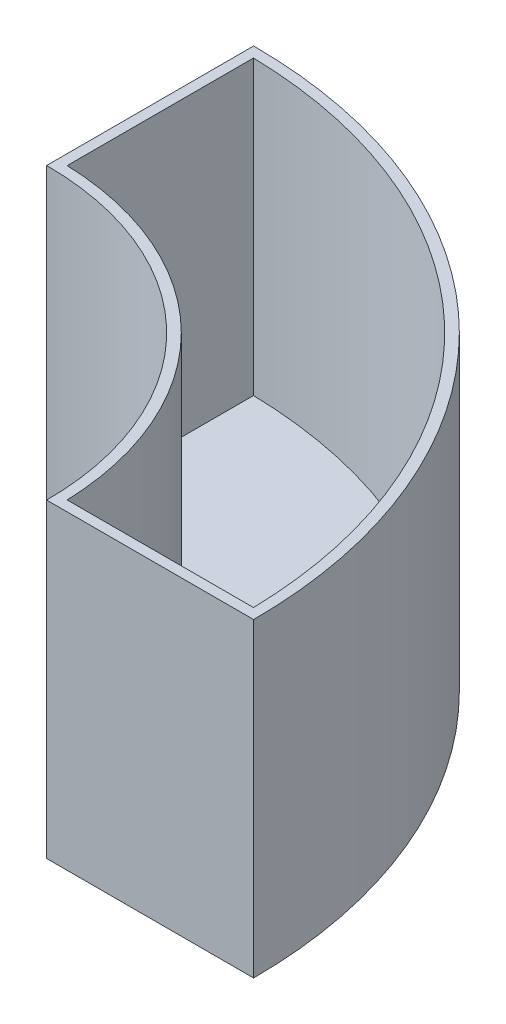
from build123d import *

# Parameters (mm, degrees)
ESTRUSIONE_ESTRUSIONE1_DEPTH = 120
TAGLIO_ESTRUSIONE1_DEPTH     = 113
TAGLIO_ESTRUSIONE2_DEPTH     = 5
RACCORDO1_SIZE               = 5


with BuildPart() as part:
    # Schizzo1 → Estrusione-Estrusione1 (new body)
    with BuildSketch(Plane(origin=(0, 0, 0), x_dir=(1, 0, 0), z_dir=(0, 1, 0))):
        with BuildLine():
            Line((0, 112), (0, 192))
            ThreePointArc((0, 192), (135.764501988, 135.764501988), (192, 0))
            Line((192, 0), (112, 0))
            ThreePointArc((112, 0), (79.195959493, 79.195959493), (0, 112))
        make_face()
    extrude(amount=ESTRUSIONE_ESTRUSIONE1_DEPTH)

    # Schizzo2 → Taglio-Estrusione1 (cut)
    with BuildSketch(Plane(origin=(0, 120, 0), x_dir=(1, 0, 0), z_dir=(0, 1, 0))):
        with BuildLine():
            Line((4, 115.93101397), (4, 187.957441992))
            ThreePointArc((4, 187.957441992), (132.936074863, 132.936074863), (187.957441992, 4))
            Line((187.957441992, 4), (115.93101397, 4))
            ThreePointArc((115.93101397, 4), (82.024386618, 82.024386618), (4, 115.93101397))
        make_face()
    extrude(amount=-TAGLIO_ESTRUSIONE1_DEPTH, mode=Mode.SUBTRACT)

    # Schizzo3 → Taglio-Estrusione2 (cut)
    with BuildSketch(Plane.XZ):
        with BuildLine():
            Line((34.489575502, -148.035364632), (24.129203459, -109.369929782))
            ThreePointArc((24.129203459, -109.369929782), (28.987733051, -108.183692544), (33.788461722, -106.781739331))
            Line((33.788461722, -106.781739331), (44.148833765, -145.447174181))
            ThreePointArc((44.148833765, -145.447174181), (39.340494856, -146.820725596), (34.489575502, -148.035364632))
        make_face()
        with BuildLine():
            Line((145.447174181, -44.148833765), (106.781739331, -33.788461722))
            ThreePointArc((106.781739331, -33.788461722), (108.183692544, -28.987733051), (109.369929782, -24.129203459))
            Line((109.369929782, -24.129203459), (148.035364632, -34.489575502))
            ThreePointArc((148.035364632, -34.489575502), (146.820725596, -39.340494856), (145.447174181, -44.148833765))
        make_face()
    extrude(amount=-TAGLIO_ESTRUSIONE2_DEPTH, mode=Mode.SUBTRACT)

    # Raccordo1
    # a fillet whose section is not a circle: 5 mm, written as the material it takes off along each edge
    with BuildSketch(Plane(origin=(0, 0, 0), x_dir=(0.9892644198784365, 0, -0.14613660582681076), z_dir=(0.14613660582681076, 0, 0.9892644198784365))) as raccordo1_piece_1_section:
        with BuildLine():
            Bezier((152 + RACCORDO1_SIZE, 0), (152, 0), (152, RACCORDO1_SIZE), weights=[1, 1.5, 1])
            Line((152, RACCORDO1_SIZE), (152, 0))
            Line((152, 0), (152 + RACCORDO1_SIZE, 0))
        make_face()
    raccordo1_piece_1 = revolve(axis=Axis((0, 0, 0), (0, 1, 0)), revolution_arc=13.193793896, mode=Mode.PRIVATE)
    raccordo1_piece_1 = split(raccordo1_piece_1, bisect_by=Plane(origin=(-1.294095226, 0, -4.829629131), z_dir=(0.2588190451025214, 0, 0.9659258262890682)), keep=Keep.TOP, mode=Mode.PRIVATE)
    raccordo1_piece_1 = split(raccordo1_piece_1, bisect_by=Plane(origin=(1.294095225, 0, 4.829629131), z_dir=(-0.25881904510252096, 0, -0.9659258262890682)), keep=Keep.TOP, mode=Mode.PRIVATE)
    add(raccordo1_piece_1, mode=Mode.SUBTRACT)
    with BuildSketch(Plane(origin=(0, 0, 0), x_dir=(0.36807419687030923, 0, -0.9297964215882295), z_dir=(0.9297964215882295, 0, 0.36807419687030923))) as raccordo1_piece_2_section:
        with BuildLine():
            Bezier((152 + RACCORDO1_SIZE, 0), (152, 0), (152, RACCORDO1_SIZE), weights=[1, 1.5, 1])
            Line((152, RACCORDO1_SIZE), (152, 0))
            Line((152, 0), (152 + RACCORDO1_SIZE, 0))
        make_face()
    raccordo1_piece_2 = revolve(axis=Axis((0, 0, 0), (0, 1, 0)), revolution_arc=13.193793896, mode=Mode.PRIVATE)
    raccordo1_piece_2 = split(raccordo1_piece_2, bisect_by=Plane(origin=(-4.829629131, 0, -1.294095225), z_dir=(0.965925826289068, 0, 0.2588190451025222)), keep=Keep.TOP, mode=Mode.PRIVATE)
    raccordo1_piece_2 = split(raccordo1_piece_2, bisect_by=Plane(origin=(4.829629131, 0, 1.294095226), z_dir=(-0.965925826289068, 0, -0.2588190451025218)), keep=Keep.TOP, mode=Mode.PRIVATE)
    add(raccordo1_piece_2, mode=Mode.SUBTRACT)


solid = part.part
